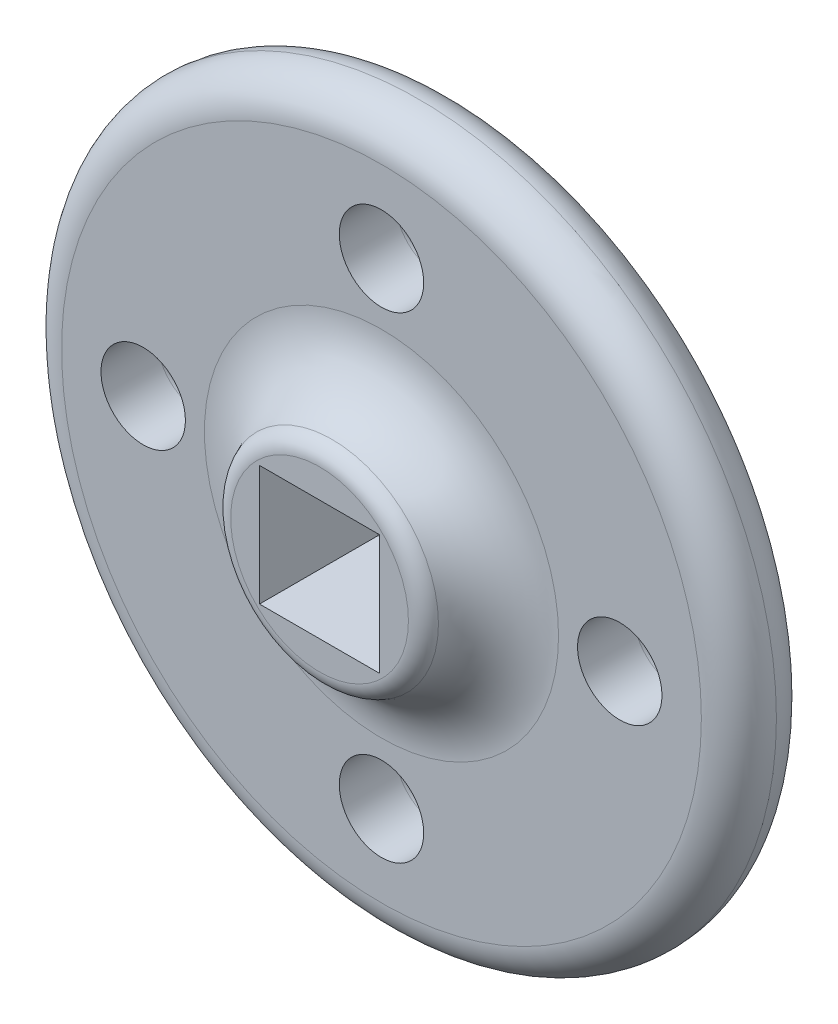
from build123d import *

# Parameters (mm, degrees)
SKETCH1_R           = 19.05
SKETCH1_R_2         = 5.5
SKETCH1_R_3         = 2.25
SKETCH1_W           = 6.4
SKETCH1_H           = 6.4
BOSS_EXTRUDE1_DEPTH = 4
BOSS_EXTRUDE2_START = 4
SKETCH1_3_R         = 5.5
SKETCH1_3_W         = 6.4
SKETCH1_3_H         = 6.4
BOSS_EXTRUDE2_DEPTH = 3.3
FILLET1_R           = 4
FILLET2_R           = 1
FILLET3_R           = 2
FILLET4_R           = 1


# Some blends are built 0.0001 mm under size
with BuildPart() as part:
    # Sketch1 → Boss-Extrude1 (new body)
    # profile 1 of 2: a face of its own
    with BuildSketch(Plane.XY):
        Circle(SKETCH1_R)
        Circle(SKETCH1_R_2, mode=Mode.SUBTRACT)
        with Locations((12.7, 0)):
            Circle(SKETCH1_R_3, mode=Mode.SUBTRACT)
        with Locations((0, -12.7)):
            Circle(SKETCH1_R_3, mode=Mode.SUBTRACT)
        with Locations((-12.7, 0)):
            Circle(SKETCH1_R_3, mode=Mode.SUBTRACT)
        with Locations((0, 12.7)):
            Circle(SKETCH1_R_3, mode=Mode.SUBTRACT)
    # profile 2 of 2: a face of its own
    with BuildSketch(Plane.XY):
        Circle(SKETCH1_R_2)
        Rectangle(SKETCH1_W, SKETCH1_H, mode=Mode.SUBTRACT)
    extrude(amount=BOSS_EXTRUDE1_DEPTH)

    # Sketch1<3> → Boss-Extrude2 (add)
    with BuildSketch(Plane.XY.offset(BOSS_EXTRUDE2_START)):
        Circle(SKETCH1_3_R)
        Rectangle(SKETCH1_3_W, SKETCH1_3_H, mode=Mode.SUBTRACT)
    extrude(amount=BOSS_EXTRUDE2_DEPTH)

    # Fillet1
    # the kernel refuses this fillet: 4 mm, written as the material it adds along each edge
    with BuildSketch(Plane(origin=(0, 0, 4), x_dir=(1, 0, 0), z_dir=(0, -1, 0))) as fillet1_piece_1:
        with BuildLine():
            CenterArc((9.438273734, 4), FILLET1_R, 190.078658108, 79.921341892)
            Line((5.5, 3.3), (5.421234525, 3.286))
            ThreePointArc((5.421234525, 3.286), (5.42, 1.65), (5.42, 0))
            Line((5.42, 0), (5.5, -0.08))
            Line((5.5, -0.08), (9.438273734, -0.08))
            Line((9.438273734, -0.08), (9.438273734, 0))
        make_face()
    revolve(axis=Axis((0, 0, 4), (0, 0, 1)))

    # Fillet2
    fillet2_edges = [part.edges().sort_by_distance(p)[0] for p in [
        (-5.5, 0, 7.3),
    ]]
    fillet(fillet2_edges, radius=FILLET2_R)

    # Fillet3
    fillet3_edges = [part.edges().sort_by_distance(p)[0] for p in [
        (-19.05, 0, 0),
        (-19.05, 0, 4),
    ]]
    fillet(fillet3_edges, radius=FILLET3_R - 0.0001)  # a hair under: the kernel refuses the full size

    # Fillet4
    fillet4_edges = [part.edges().sort_by_distance(p)[0] for p in [
        (0, -3.2, 0),
        (3.2, 0, 0),
        (0, 3.2, 0),
        (-3.2, 0, 0),
        (-2.25, 12.7, 0),
        (-14.95, 0, 0),
        (-2.25, -12.7, 0),
        (10.45, 0, 0),
    ]]
    fillet(fillet4_edges, radius=FILLET4_R)


solid = part.part
